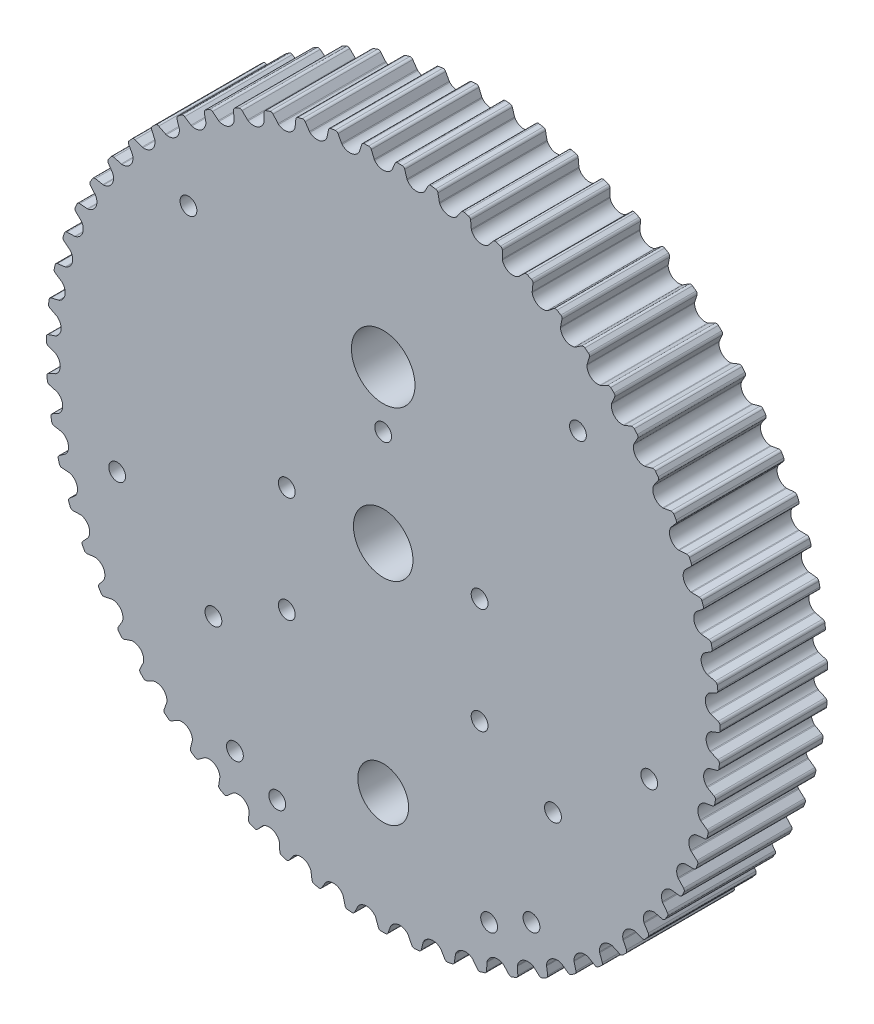
from build123d import *

# Parameters (mm, degrees)
BOSS_EXTRUDE1_DEPTH = 25.4
SKETCH3_R           = 7.025
SKETCH3_R_2         = 6
SKETCH3_R_3         = 7.5
CUT_EXTRUDE1_DEPTH  = 116.295759829
SKETCH4_R           = 1.985
CUT_EXTRUDE2_DEPTH  = 116.295759829


with BuildPart() as part:
    # Sketch1 → Boss-Extrude1 (new body)
    with BuildSketch(Plane.XY):
        with BuildLine():
            ThreePointArc((-2.00858237, 77.225966305), (-2.06415437, 77.308346172), (-2.108533634, 77.397257198))
            Line((-2.108533634, 77.397257198), (-2.806365183, 79.058376339))
            ThreePointArc((-2.806365183, 79.058376339), (-3.057533909, 79.355500397), (-3.433430091, 79.455852257))
            ThreePointArc((-3.433430091, 79.455852257), (-3.69885733, 79.443938437), (-3.964243287, 79.431137945))
            ThreePointArc((-3.964243287, 79.431137945), (-4.229584998, 79.417450921), (-4.494879503, 79.402877519))
            ThreePointArc((-4.494879503, 79.402877519), (-4.858915954, 79.265597157), (-5.079252563, 78.944941245))
            Line((-5.079252563, 78.944941245), (-5.608222375, 77.222594994))
            ThreePointArc((-5.608222375, 77.222594994), (-5.643528429, 77.129707039), (-5.690621893, 77.042203352))
            ThreePointArc((-5.690621893, 77.042203352), (-7.591122322, 75.861842835), (-9.687824439, 76.642222909))
            ThreePointArc((-9.687824439, 76.642222909), (-9.751322675, 76.718660228), (-9.804334089, 76.802710687))
            Line((-9.804334089, 76.802710687), (-10.664092012, 78.386093769))
            ThreePointArc((-10.664092012, 78.386093769), (-10.943596627, 78.656733022), (-11.327616714, 78.719159038))
            ThreePointArc((-11.327616714, 78.719159038), (-11.590538753, 78.680876402), (-11.853331429, 78.64171561))
            ThreePointArc((-11.853331429, 78.64171561), (-12.11599181, 78.601677097), (-12.378516965, 78.560761311))
            ThreePointArc((-12.378516965, 78.560761311), (-12.727075727, 78.3879168), (-12.914390416, 78.046915859))
            Line((-12.914390416, 78.046915859), (-13.26924135, 76.280459947))
            ThreePointArc((-13.26924135, 76.280459947), (-13.295123307, 76.184518226), (-13.333270199, 76.092760369))
            ThreePointArc((-13.333270199, 76.092760369), (-15.10680066, 74.729036594), (-17.270784557, 75.29677467))
            ThreePointArc((-17.270784557, 75.29677467), (-17.341577955, 75.366509771), (-17.402694666, 75.444864333))
            Line((-17.402694666, 75.444864333), (-18.415834303, 76.934774984))
            ThreePointArc((-18.415834303, 76.934774984), (-18.720896964, 77.176239697), (-19.109224393, 77.20011945))
            ThreePointArc((-19.109224393, 77.20011945), (-19.367028194, 77.135848468), (-19.624615838, 77.070716574))
            ThreePointArc((-19.624615838, 77.070716574), (-19.881984453, 77.004724493), (-20.139131164, 76.937872962))
            ThreePointArc((-20.139131164, 76.937872962), (-20.468748104, 76.73118211), (-20.621179254, 76.373225158))
            Line((-20.621179254, 76.373225158), (-20.798384643, 74.58021542))
            ThreePointArc((-20.798384643, 74.58021542), (-20.814585277, 74.482173443), (-20.843406476, 74.387073348))
            ThreePointArc((-20.843406476, 74.387073348), (-22.472340826, 72.853539614), (-24.682099858, 73.202993255))
            ThreePointArc((-24.682099858, 73.202993255), (-24.759484842, 73.265333081), (-24.828099445, 73.337213021))
            Line((-24.828099445, 73.337213021), (-25.984551758, 74.71884384))
            ThreePointArc((-25.984551758, 74.71884384), (-26.312140616, 74.928734228), (-26.700916015, 74.913830392))
            ThreePointArc((-26.700916015, 74.913830392), (-26.951039407, 74.824209818), (-27.200861999, 74.733754131))
            ThreePointArc((-27.200861999, 74.733754131), (-27.450381001, 74.642464341), (-27.69959363, 74.550341466))
            ThreePointArc((-27.69959363, 74.550341466), (-28.006992866, 74.311858458), (-28.123025549, 73.940503033))
            Line((-28.123025549, 73.940503033), (-28.120824246, 72.138759204))
            ThreePointArc((-28.120824246, 72.138759204), (-28.127182546, 72.039591358), (-28.146391615, 71.942094172))
            ThreePointArc((-28.146391615, 71.942094172), (-29.614540772, 70.253991426), (-31.848113362, 70.381687605))
            ThreePointArc((-31.848113362, 70.381687605), (-31.931320845, 70.436012594), (-32.006751418, 70.500703539))
            Line((-32.006751418, 70.500703539), (-33.295023065, 71.760323257))
            ThreePointArc((-33.295023065, 71.760323257), (-33.641882394, 71.936553336), (-34.027241938, 71.88301403))
            ThreePointArc((-34.027241938, 71.88301403), (-34.267199083, 71.768934554), (-34.506773772, 71.654054064))
            ThreePointArc((-34.506773772, 71.654054064), (-34.745963331, 71.538373844), (-34.98476509, 71.421895183))
            ThreePointArc((-34.98476509, 71.421895183), (-35.26689155, 71.153990171), (-35.345372581, 70.77292697))
            Line((-35.345372581, 70.77292697), (-35.163786463, 68.98035559))
            ThreePointArc((-35.163786463, 68.98035559), (-35.160239239, 68.881047449), (-35.169645269, 68.782122143))
            ThreePointArc((-35.169645269, 68.782122143), (-36.462418108, 66.956227509), (-38.697606007, 66.860897123))
            ThreePointArc((-38.697606007, 66.860897123), (-38.785809036, 66.90666737), (-38.867305915, 66.963526391))
            Line((-38.867305915, 66.963526391), (-40.274593474, 68.088616342))
            ThreePointArc((-40.274593474, 68.088616342), (-40.637276031, 68.229434657), (-41.015389843, 68.137791981))
            ThreePointArc((-41.015389843, 68.137791981), (-41.242795939, 68.000387375), (-41.469741725, 67.862223816))
            ThreePointArc((-41.469741725, 67.862223816), (-41.696224666, 67.723302847), (-41.922242237, 67.583626019))
            ThreePointArc((-41.922242237, 67.583626019), (-42.176292022, 67.288961563), (-42.21644142, 66.901977763))
            Line((-42.21644142, 66.901977763), (-41.857275173, 65.136394212))
            ThreePointArc((-41.857275173, 65.136394212), (-41.843857678, 65.037932745), (-41.843367187, 64.938562482))
            ThreePointArc((-41.843367187, 64.938562482), (-42.947915551, 62.993022521), (-45.162504458, 62.675613008))
            ThreePointArc((-45.162504458, 62.675613008), (-45.254826431, 62.712373626), (-45.341579664, 62.760835633))
            Line((-45.341579664, 62.760835633), (-46.853896879, 63.740214167))
            ThreePointArc((-46.853896879, 63.740214167), (-47.228798161, 63.844221204), (-47.595908377, 63.715385943))
            ThreePointArc((-47.595908377, 63.715385943), (-47.80850336, 63.556021795), (-48.020564753, 63.395948299))
            ThreePointArc((-48.020564753, 63.395948299), (-48.232090189, 63.235167241), (-48.443077306, 63.073680416))
            ThreePointArc((-48.443077306, 63.073680416), (-48.666525555, 62.755185023), (-48.667944298, 62.366126644))
            Line((-48.667944298, 62.366126644), (-48.134767477, 60.645078084))
            ThreePointArc((-48.134767477, 60.645078084), (-48.11161306, 60.548441845), (-48.101230924, 60.449614213))
            ThreePointArc((-48.101230924, 60.449614213), (-49.006577314, 58.403764575), (-51.17855765, 57.867430492))
            ThreePointArc((-51.17855765, 57.867430492), (-51.274081029, 57.894816138), (-51.365228424, 57.934399494))
            Line((-51.365228424, 57.934399494), (-52.967545206, 58.758333108))
            ThreePointArc((-52.967545206, 58.758333108), (-53.350939277, 58.824495197), (-53.70339739, 58.659747773))
            ThreePointArc((-53.70339739, 58.659747773), (-53.899068396, 58.480007918), (-54.094137835, 58.299615367))
            ThreePointArc((-54.094137835, 58.299615367), (-54.288603529, 58.118572134), (-54.482463308, 57.936880239))
            ThreePointArc((-54.482463308, 57.936880239), (-54.673089293, 57.597719261), (-54.635763281, 57.210452939))
            Line((-54.635763281, 57.210452939), (-53.933874836, 55.551043924))
            ThreePointArc((-53.933874836, 55.551043924), (-53.901213616, 55.457193328), (-53.881043017, 55.359890519))
            ThreePointArc((-53.881043017, 55.359890519), (-54.578189694, 53.234063777), (-56.685975343, 52.484135454))
            ThreePointArc((-56.685975343, 52.484135454), (-56.783750775, 52.501873957), (-56.878386467, 52.532185265))
            Line((-56.878386467, 52.532185265), (-58.554778273, 53.192485336))
            ThreePointArc((-58.554778273, 53.192485336), (-58.942854789, 53.220144929), (-59.277157912, 53.021122677))
            ThreePointArc((-59.277157912, 53.021122677), (-59.453960275, 52.822793448), (-59.630099072, 52.623874664))
            ThreePointArc((-59.630099072, 52.623874664), (-59.805572338, 52.424368545), (-59.980378113, 52.224277318))
            ThreePointArc((-59.980378113, 52.224277318), (-60.136287306, 51.867821488), (-60.060587502, 51.48619605))
            Line((-60.060587502, 51.48619605), (-59.196963116, 49.904918532))
            ThreePointArc((-59.196963116, 49.904918532), (-59.155119696, 49.814786308), (-59.125361097, 49.719975362))
            ThreePointArc((-59.125361097, 49.719975362), (-59.607379505, 47.535298937), (-61.630022345, 46.579229498))
            ThreePointArc((-61.630022345, 46.579229498), (-61.729078094, 46.587144566), (-61.826261552, 46.607882577))
            Line((-61.826261552, 46.607882577), (-63.560067646, 47.097986747))
            ThreePointArc((-63.560067646, 47.097986747), (-63.948969729, 47.08686895), (-64.261795408, 46.855549842))
            ThreePointArc((-64.261795408, 46.855549842), (-64.417971986, 46.640602325), (-64.573429595, 46.425134253))
            ThreePointArc((-64.573429595, 46.425134253), (-64.7281665, 46.209148029), (-64.882180973, 45.992646066))
            ThreePointArc((-64.882180973, 45.992646066), (-65.001823879, 45.622438002), (-64.888502621, 45.250246213))
            Line((-64.888502621, 45.250246213), (-63.871725381, 43.762815639))
            ThreePointArc((-63.871725381, 43.762815639), (-63.821115619, 43.677297561), (-63.782064776, 43.585920752))
            ThreePointArc((-63.782064776, 43.585920752), (-64.044164399, 41.36410694), (-65.961562497, 40.211398233))
            ThreePointArc((-65.961562497, 40.211398233), (-66.060914102, 40.209411201), (-66.159679472, 40.220369813))
            Line((-66.159679472, 40.220369813), (-67.933668512, 40.535407206))
            ThreePointArc((-67.933668512, 40.535407206), (-68.319531077, 40.485622513), (-68.60777031, 40.224305502))
            ThreePointArc((-68.60777031, 40.224305502), (-68.74176895, 39.994875943), (-68.875000363, 39.765))
            ThreePointArc((-68.875000363, 39.765), (-69.007463062, 39.53468024), (-69.139155569, 39.303919234))
            ThreePointArc((-69.139155569, 39.303919234), (-69.221343123, 38.923638231), (-69.071526649, 38.5645791))
            Line((-69.071526649, 38.5645791), (-67.911701744, 37.185778223))
            ThreePointArc((-67.911701744, 37.185778223), (-67.852828622, 37.105724209), (-67.80487364, 37.018689679))
            ThreePointArc((-67.80487364, 37.018689679), (-67.844449614, 34.781819864), (-69.637547006, 33.443928026))
            ThreePointArc((-69.637547006, 33.443928026), (-69.736207066, 33.432058643), (-69.835572775, 33.433128944))
            Line((-69.835572775, 33.433128944), (-71.632114059, 33.569968577))
            ThreePointArc((-71.632114059, 33.569968577), (-72.011102232, 33.48201177), (-72.271890367, 33.193293943))
            ThreePointArc((-72.271890367, 33.193293943), (-72.382379331, 32.951662514), (-72.492060434, 32.709663312))
            ThreePointArc((-72.492060434, 32.709663312), (-72.600932454, 32.467299037), (-72.708994175, 32.224572395))
            ThreePointArc((-72.708994175, 32.224572395), (-72.75290956, 31.837997856), (-72.568086813, 31.495639874))
            Line((-72.568086813, 31.495639874), (-71.276741104, 30.239171836))
            ThreePointArc((-71.276741104, 30.239171836), (-71.210189731, 30.165377498), (-71.153807206, 30.083550238))
            ThreePointArc((-71.153807206, 30.083550238), (-70.970466208, 27.853855436), (-72.621442287, 26.344077037))
            ThreePointArc((-72.621442287, 26.344077037), (-72.718430274, 26.322443267), (-72.81740878, 26.313614619))
            Line((-72.81740878, 26.313614619), (-74.618647475, 26.270896518))
            ThreePointArc((-74.618647475, 26.270896518), (-74.986994701, 26.145641752), (-75.217739908, 25.832392516))
            ThreePointArc((-75.217739908, 25.832392516), (-75.303621106, 25.58096066), (-75.388661841, 25.329243295))
            ThreePointArc((-75.388661841, 25.329243295), (-75.472861162, 25.07724323), (-75.556218131, 24.824963278))
            ThreePointArc((-75.556218131, 24.824963278), (-75.561424896, 24.435937154), (-75.343432728, 24.113682829))
            Line((-75.343432728, 24.113682829), (-73.933400189, 22.992034974))
            ThreePointArc((-73.933400189, 22.992034974), (-73.859831981, 22.925233714), (-73.79558227, 22.849426958))
            ThreePointArc((-73.79558227, 22.849426958), (-73.391146424, 20.64906688), (-74.883593049, 18.982406775))
            ThreePointArc((-74.883593049, 18.982406775), (-74.977945052, 18.951223623), (-75.075552662, 18.93258377))
            Line((-75.075552662, 18.93258377), (-76.863587248, 18.710732487))
            ThreePointArc((-76.863587248, 18.710732487), (-77.217632726, 18.5494246), (-77.416041757, 18.214757166))
            ThreePointArc((-77.416041757, 18.214757166), (-77.476461664, 17.956023725), (-77.536016856, 17.697089878))
            ThreePointArc((-77.536016856, 17.697089878), (-77.594706668, 17.437958512), (-77.652530446, 17.178632522))
            ThreePointArc((-77.652530446, 17.178632522), (-77.618976844, 16.791021131), (-77.369981759, 16.492073171))
            Line((-77.369981759, 16.492073171), (-75.855275927, 15.516392939))
            ThreePointArc((-75.855275927, 15.516392939), (-75.775422038, 15.457248658), (-75.703943683, 15.388215808))
            ThreePointArc((-75.703943683, 15.388215808), (-75.082432455, 13.239058619), (-76.401517019, 11.432080827))
            ThreePointArc((-76.401517019, 11.432080827), (-76.492295327, 11.391658204), (-76.587561973, 11.363392398))
            Line((-76.587561973, 11.363392398), (-78.344622159, 10.96461279))
            ThreePointArc((-78.344622159, 10.96461279), (-78.680847227, 10.768854933), (-78.844948203, 10.416095376))
            ThreePointArc((-78.844948203, 10.416095376), (-78.879306338, 10.15263176), (-78.912784101, 9.889054831))
            ThreePointArc((-78.912784101, 9.889054831), (-78.945381118, 9.625367529), (-78.977097026, 9.361572799))
            ThreePointArc((-78.977097026, 9.361572799), (-78.905116528, 8.979228396), (-78.627593151, 8.70655788))
            Line((-78.627593151, 8.70655788), (-77.023267853, 7.88654202))
            ThreePointArc((-77.023267853, 7.88654202), (-76.937921907, 7.83564252), (-76.859925292, 7.774069656))
            ThreePointArc((-76.859925292, 7.774069656), (-76.02751554, 5.697474646), (-77.160128389, 3.768137723))
            ThreePointArc((-77.160128389, 3.768137723), (-77.246430806, 3.718877369), (-77.338409685, 3.681266527))
            Line((-77.338409685, 3.681266527), (-79.047033017, 3.109521846))
            ThreePointArc((-79.047033017, 3.109521846), (-79.362096118, 2.881259547), (-79.49025813, 2.513913751))
            ThreePointArc((-79.49025813, 2.513913751), (-79.498213027, 2.248338379), (-79.505280645, 1.982737914))
            ThreePointArc((-79.505280645, 1.982737914), (-79.511460903, 1.717115319), (-79.516753735, 1.45147356))
            ThreePointArc((-79.516753735, 1.45147356), (-79.407061715, 1.078196055), (-79.103768198, 0.834512905))
            Line((-79.103768198, 0.834512905), (-77.425767939, 0.178311104))
            ThreePointArc((-77.425767939, 0.178311104), (-77.335778143, 0.136162246), (-77.252038432, 0.082661306))
            ThreePointArc((-77.252038432, 0.082661306), (-76.217003018, -1.90073339), (-77.151887737, -3.933254827))
            ThreePointArc((-77.151887737, -3.933254827), (-77.23285655, -3.990863341), (-77.320633535, -4.037445425))
            Line((-77.320633535, -4.037445425), (-78.963838947, -4.776472924))
            ThreePointArc((-78.963838947, -4.776472924), (-79.254608844, -5.034971091), (-79.34555816, -5.413252278))
            ThreePointArc((-79.34555816, -5.413252278), (-79.32703076, -5.678299998), (-79.30761799, -5.943284343))
            ThreePointArc((-79.30761799, -5.943284343), (-79.287320068, -6.208202354), (-79.26613722, -6.473051076))
            ThreePointArc((-79.26613722, -6.473051076), (-79.119823847, -6.833551883), (-78.793774457, -7.045825835))
            Line((-78.793774457, -7.045825835), (-77.058775958, -7.531691949))
            ThreePointArc((-77.058775958, -7.531691949), (-76.96503667, -7.564671269), (-76.876386108, -7.609568568))
            ThreePointArc((-76.876386108, -7.609568568), (-75.649011679, -9.480051083), (-76.376876962, -11.595556923))
            ThreePointArc((-76.376876962, -11.595556923), (-76.451707468, -11.660941057), (-76.534410191, -11.71603143))
            Line((-76.534410191, -11.71603143), (-78.09586677, -12.61499696))
            ThreePointArc((-78.09586677, -12.61499696), (-78.35945366, -12.901161924), (-78.412286386, -13.286618975))
            ThreePointArc((-78.412286386, -13.286618975), (-78.367460821, -13.54850488), (-78.321760597, -13.81023957))
            ThreePointArc((-78.321760597, -13.81023957), (-78.275186224, -14.071820124), (-78.227738222, -14.333243622))
            ThreePointArc((-78.227738222, -14.333243622), (-78.046257623, -14.677384912), (-77.700692786, -14.856139991))
            Line((-77.700692786, -14.856139991), (-75.925939242, -15.166841663))
            ThreePointArc((-75.925939242, -15.166841663), (-75.829382086, -15.190323683), (-75.736701721, -15.226171131))
            ThreePointArc((-75.736701721, -15.226171131), (-74.329186474, -16.965151769), (-74.842798471, -19.142617164))
            ThreePointArc((-74.842798471, -19.142617164), (-74.910746969, -19.215127103), (-74.987553495, -19.278178251))
            Line((-74.987553495, -19.278178251), (-76.451742783, -20.328147489))
            ThreePointArc((-76.451742783, -20.328147489), (-76.685527021, -20.639135214), (-76.699718081, -21.027937283))
            ThreePointArc((-76.699718081, -21.027937283), (-76.629039849, -21.284058633), (-76.55750636, -21.539942431))
            ThreePointArc((-76.55750636, -21.539942431), (-76.485118413, -21.795585823), (-76.411876815, -22.050985954))
            ThreePointArc((-76.411876815, -22.050985954), (-76.197032628, -22.375347496), (-75.835386721, -22.518807154))
            Line((-75.835386721, -22.518807154), (-74.03851643, -22.651256491))
            ThreePointArc((-74.03851643, -22.651256491), (-73.940101034, -22.665007835), (-73.844311965, -22.691449165))
            ThreePointArc((-73.844311965, -22.691449165), (-72.270644421, -24.281645156), (-72.564898624, -26.499429476))
            ThreePointArc((-72.564898624, -26.499429476), (-72.625289812, -26.578344583), (-72.695436802, -26.648729876))
            Line((-72.695436802, -26.648729876), (-74.047807028, -27.839267755))
            ThreePointArc((-74.047807028, -27.839267755), (-74.249465162, -28.171987505), (-74.224873518, -28.560270502))
            ThreePointArc((-74.224873518, -28.560270502), (-74.129045051, -28.808081849), (-74.03238923, -29.055571668))
            ThreePointArc((-74.03238923, -29.055571668), (-73.934907133, -29.302737198), (-73.836599848, -29.54957568))
            ThreePointArc((-73.836599848, -29.54957568), (-73.590527289, -29.850933824), (-73.216394513, -29.957672294))
            Line((-73.216394513, -29.957672294), (-71.415265579, -29.910552956))
            ThreePointArc((-71.415265579, -29.910552956), (-71.315970039, -29.914436957), (-71.218024262, -29.931209383))
            ThreePointArc((-71.218024262, -29.931209383), (-69.493844234, -31.356816644), (-69.565816213, -33.592878553))
            ThreePointArc((-69.565816213, -33.592878553), (-69.618049897, -33.677414533), (-69.680840198, -33.754434451))
            Line((-69.680840198, -33.754434451), (-70.9079509, -35.073708871))
            ThreePointArc((-70.9079509, -35.073708871), (-71.075478761, -35.424853928), (-71.012348816, -35.808758923))
            ThreePointArc((-71.012348816, -35.808758923), (-70.8923225, -36.045797405), (-70.771504955, -36.282433579))
            ThreePointArc((-70.771504955, -36.282433579), (-70.649897529, -36.518664806), (-70.527501579, -36.754488447))
            ThreePointArc((-70.527501579, -36.754488447), (-70.252646228, -37.02984816), (-69.869744883, -37.098804628))
            Line((-69.869744883, -37.098804628), (-68.082257733, -36.872584907))
            ThreePointArc((-68.082257733, -36.872584907), (-67.983068894, -36.866562964), (-67.883939837, -36.873499794))
            ThreePointArc((-67.883939837, -36.873499794), (-66.026383002, -38.12035), (-65.875357467, -40.35246651))
            ThreePointArc((-65.875357467, -40.35246651), (-65.918914524, -40.441783207), (-65.973724099, -40.524672291))
            Line((-65.973724099, -40.524672291), (-67.0633797, -41.95957171))
            ThreePointArc((-67.0633797, -41.95957171), (-67.195112319, -42.325652237), (-67.094071488, -42.701363809))
            ThreePointArc((-67.094071488, -42.701363809), (-66.951040198, -42.925273632), (-66.807261668, -43.148704365))
            ThreePointArc((-66.807261668, -43.148704365), (-66.662737502, -43.371653516), (-66.517469313, -43.594118596))
            ThreePointArc((-66.517469313, -43.594118596), (-66.216562807, -43.840743229), (-65.828698337, -43.871232375))
            Line((-65.828698337, -43.871232375), (-64.072617824, -43.468160543))
            ThreePointArc((-64.072617824, -43.468160543), (-63.974521468, -43.452292506), (-63.87519432, -43.449324799))
            ThreePointArc((-63.87519432, -43.449324799), (-61.902721912, -44.505026192), (-61.530199822, -46.711013526))
            ThreePointArc((-61.530199822, -46.711013526), (-61.564647364, -46.804223271), (-61.61093149, -46.892157731))
            Line((-61.61093149, -46.892157731), (-62.552302502, -48.428421475))
            ThreePointArc((-62.552302502, -48.428421475), (-62.646930663, -48.805799198), (-62.508983134, -49.169583358))
            ThreePointArc((-62.508983134, -49.169583358), (-62.34436838, -49.378139204), (-62.179057801, -49.586143942))
            ThreePointArc((-62.179057801, -49.586143942), (-62.013053241, -49.793595248), (-61.846356553, -50.000490808))
            ThreePointArc((-61.846356553, -50.000490808), (-61.522389436, -50.215929295), (-61.133416613, -50.207648104))
            Line((-61.133416613, -50.207648104), (-59.426195452, -49.631730072))
            ThreePointArc((-59.426195452, -49.631730072), (-59.330166505, -49.606173643), (-59.231628424, -49.593330893))
            ThreePointArc((-59.231628424, -49.593330893), (-57.163843761, -50.447391438), (-56.573527408, -52.605325504))
            ThreePointArc((-56.573527408, -52.605325504), (-56.598523079, -52.701501936), (-56.635821764, -52.793607841))
            Line((-56.635821764, -52.793607841), (-57.419552419, -54.41596783))
            ThreePointArc((-57.419552419, -54.41596783), (-57.476135664, -54.800892201), (-57.302652422, -55.149133496))
            ThreePointArc((-57.302652422, -55.149133496), (-57.118090219, -55.340262646), (-56.932890522, -55.530774142))
            ThreePointArc((-56.932890522, -55.530774142), (-56.747055396, -55.72066586), (-56.560586916, -55.90993568))
            ThreePointArc((-56.560586916, -55.90993568), (-56.216778918, -56.092046896), (-55.830563529, -56.045077669))
            Line((-55.830563529, -56.045077669), (-54.189168851, -55.302037168))
            ThreePointArc((-54.189168851, -55.302037168), (-54.096161693, -55.26704634), (-53.999391995, -55.244456184))
            ThreePointArc((-53.999391995, -55.244456184), (-51.856845649, -55.888387845), (-51.054601862, -57.976822123))
            ThreePointArc((-51.054601862, -57.976822123), (-51.069897244, -58.075009398), (-51.097839797, -58.170371358))
            Line((-51.097839797, -58.170371358), (-51.716141027, -59.862703849))
            ThreePointArc((-51.716141027, -59.862703849), (-51.734117007, -60.251349316), (-51.526822206, -60.580586769))
            ThreePointArc((-51.526822206, -60.580586769), (-51.324146817, -60.752389694), (-51.120898598, -60.923514561))
            ThreePointArc((-51.120898598, -60.923514561), (-50.91707982, -61.093959461), (-50.712692755, -61.263722491))
            ThreePointArc((-50.712692755, -61.263722491), (-50.352460794, -61.410696534), (-49.972841221, -61.325506073))
            Line((-49.972841221, -61.325506073), (-48.413585945, -60.422727774))
            ThreePointArc((-48.413585945, -60.422727774), (-48.324524922, -60.378650301), (-48.230485347, -60.34653725))
            ThreePointArc((-48.230485347, -60.34653725), (-46.034470906, -60.773940343), (-45.028272746, -62.772119037))
            ThreePointArc((-45.028272746, -62.772119037), (-45.033715825, -62.871341325), (-45.05202454, -62.96901159))
            Line((-45.05202454, -62.96901159), (-45.498751392, -64.714497422))
            ThreePointArc((-45.498751392, -64.714497422), (-45.477941452, -65.103001453), (-45.238895282, -65.409962954))
            ThreePointArc((-45.238895282, -65.409962954), (-45.020120985, -65.560732199), (-44.800844218, -65.710769721))
            ThreePointArc((-44.800844218, -65.710769721), (-44.581067429, -65.860073845), (-44.36079307, -66.008642905))
            ThreePointArc((-44.36079307, -66.008642905), (-43.987717294, -66.11901908), (-43.618466366, -65.996454046))
            Line((-43.618466366, -65.996454046), (-42.156847072, -64.942910166))
            ThreePointArc((-42.156847072, -64.942910166), (-42.072617311, -64.890184109), (-41.982242468, -64.848867317))
            ThreePointArc((-41.982242468, -64.848867317), (-39.75458491, -65.055494119), (-38.554432425, -66.94355843))
            ThreePointArc((-38.554432425, -66.94355843), (-38.549969107, -67.042829616), (-38.558462024, -67.141837494))
            Line((-38.558462024, -67.141837494), (-38.829174724, -68.923129246))
            ThreePointArc((-38.829174724, -68.923129246), (-38.769785684, -69.307630712), (-38.501363892, -69.589265541))
            ThreePointArc((-38.501363892, -69.589265541), (-38.268664964, -69.717502694), (-38.03553892, -69.84496173))
            ThreePointArc((-38.03553892, -69.84496173), (-37.801988361, -69.971641227), (-37.568015894, -70.09753977))
            ThreePointArc((-37.568015894, -70.09753977), (-37.185804097, -70.170221109), (-36.830591596, -70.011499609))
            Line((-36.830591596, -70.011499609), (-35.481134512, -68.817660739))
            ThreePointArc((-35.481134512, -68.817660739), (-35.402573128, -68.756810114), (-35.316761201, -68.706700205))
            ThreePointArc((-35.316761201, -68.706700205), (-33.079599989, -68.690497167), (-31.697420833, -70.449682663))
            ThreePointArc((-31.697420833, -70.449682663), (-31.683095476, -70.548016146), (-31.681688189, -70.647377653))
            Line((-31.681688189, -70.647377653), (-31.773696272, -72.446772047))
            ThreePointArc((-31.773696272, -72.446772047), (-31.676318367, -72.8234496), (-31.38118865, -73.076958742))
            ThreePointArc((-31.38118865, -73.076958742), (-31.136877758, -73.181389325), (-30.892219348, -73.28500313))
            ThreePointArc((-30.892219348, -73.28500313), (-30.647216149, -73.387799002), (-30.401870897, -73.489775792))
            ThreePointArc((-30.401870897, -73.489775792), (-30.014321672, -73.524039956), (-29.67667786, -73.330739435))
            Line((-29.67667786, -73.330739435), (-28.452794497, -72.008470482))
            ThreePointArc((-28.452794497, -72.008470482), (-28.380682267, -71.940100049), (-28.300286095, -71.88169504))
            ThreePointArc((-28.300286095, -71.88169504), (-26.075855141, -71.642823194), (-24.525386033, -73.2556463))
            ThreePointArc((-24.525386033, -73.2556463), (-24.501341009, -73.352064796), (-24.490047503, -73.450792433))
            Line((-24.490047503, -73.450792433), (-24.402436553, -75.250406279))
            ThreePointArc((-24.402436553, -75.250406279), (-24.268037567, -75.615516328), (-23.949133056, -75.838380296))
            ThreePointArc((-23.949133056, -75.838380296), (-23.695638272, -75.91796643), (-23.441879021, -75.996705244))
            ThreePointArc((-23.441879021, -75.996705244), (-23.187858135, -76.074595859), (-22.933578449, -76.151637405))
            ThreePointArc((-22.933578449, -76.151637405), (-22.544543434, -76.147143861), (-22.227823967, -75.921185426))
            Line((-22.227823967, -75.921185426), (-21.141677827, -74.483627694))
            ThreePointArc((-21.141677827, -74.483627694), (-21.076731436, -74.40841695), (-21.002550032, -74.342297294))
            ThreePointArc((-21.002550032, -74.342297294), (-18.81295673, -73.883130656), (-17.109606927, -75.333562412))
            ThreePointArc((-17.109606927, -75.333562412), (-17.076081206, -75.427107672), (-17.055013722, -75.524220239))
            Line((-17.055013722, -75.524220239), (-16.788654455, -77.306168165))
            ThreePointArc((-16.788654455, -77.306168165), (-16.618570107, -77.656082083), (-16.279060219, -77.846085954))
            ThreePointArc((-16.279060219, -77.846085954), (-16.018900887, -77.900036678), (-15.758562769, -77.953117959))
            ThreePointArc((-15.758562769, -77.953117959), (-15.498048769, -78.005329205), (-15.237361795, -78.056669834))
            ThreePointArc((-15.237361795, -78.056669834), (-14.850707394, -78.01346324), (-14.558059972, -77.757092568))
            Line((-14.558059972, -77.757092568), (-13.620445664, -76.218533151))
            ThreePointArc((-13.620445664, -76.218533151), (-13.563310579, -76.137229574), (-13.49608119, -76.064052399))
            ThreePointArc((-13.49608119, -76.064052399), (-11.363086703, -75.389154373), (-9.523784861, -76.662779735))
            ThreePointArc((-9.523784861, -76.662779735), (-9.481111637, -76.752522064), (-9.450479553, -76.847054413))
            Line((-9.450479553, -76.847054413), (-9.008019167, -78.593626622))
            ThreePointArc((-9.008019167, -78.593626622), (-8.803939831, -78.924866806), (-8.447198768, -79.080122237))
            ThreePointArc((-8.447198768, -79.080122237), (-8.182960469, -79.107901362), (-7.91863084, -79.134797565))
            ThreePointArc((-7.91863084, -79.134797565), (-7.654212831, -79.160810544), (-7.389709393, -79.185940009))
            ThreePointArc((-7.389709393, -79.185940009), (-7.009278353, -79.104449773), (-6.743611438, -78.82021479))
            Line((-6.743611438, -78.82021479), (-5.963847394, -77.195944583))
            ThreePointArc((-5.963847394, -77.195944583), (-5.915091447, -77.109356204), (-5.85548223, -77.029848778))
            ThreePointArc((-5.85548223, -77.029848778), (-3.800285215, -76.145926804), (-1.843311143, -77.230087912))
            ThreePointArc((-1.843311143, -77.230087912), (-1.791914521, -77.31513541), (-1.752022272, -77.406148036))
            Line((-1.752022272, -77.406148036), (-1.137858137, -79.099986307))
            ThreePointArc((-1.137858137, -79.099986307), (-0.901812046, -79.409260744), (-0.53138526, -79.528224736))
            ThreePointArc((-0.53138526, -79.528224736), (-0.265694113, -79.529556183), (0, -79.53))
            ThreePointArc((0, -79.53), (0.265694113, -79.529556183), (0.53138526, -79.528224736))
            ThreePointArc((0.53138526, -79.528224736), (0.901812046, -79.409260744), (1.137858137, -79.099986307))
            Line((1.137858137, -79.099986307), (1.752022272, -77.406148036))
            ThreePointArc((1.752022272, -77.406148036), (1.791914521, -77.31513541), (1.843311143, -77.230087912))
            ThreePointArc((1.843311143, -77.230087912), (3.800285215, -76.145926804), (5.85548223, -77.029848778))
            ThreePointArc((5.85548223, -77.029848778), (5.915091447, -77.109356204), (5.963847394, -77.195944583))
            Line((5.963847394, -77.195944583), (6.743611438, -78.82021479))
            ThreePointArc((6.743611438, -78.82021479), (7.009278353, -79.104449773), (7.389709393, -79.185940009))
            ThreePointArc((7.389709393, -79.185940009), (7.654212831, -79.160810544), (7.91863084, -79.134797565))
            ThreePointArc((7.91863084, -79.134797565), (8.182960469, -79.107901362), (8.447198768, -79.080122237))
            ThreePointArc((8.447198768, -79.080122237), (8.803939831, -78.924866806), (9.008019167, -78.593626622))
            Line((9.008019167, -78.593626622), (9.450479553, -76.847054413))
            ThreePointArc((9.450479553, -76.847054413), (9.481111637, -76.752522064), (9.523784861, -76.662779735))
            ThreePointArc((9.523784861, -76.662779735), (11.363086703, -75.389154373), (13.49608119, -76.064052399))
            ThreePointArc((13.49608119, -76.064052399), (13.563310579, -76.137229574), (13.620445664, -76.218533151))
            Line((13.620445664, -76.218533151), (14.558059972, -77.757092568))
            ThreePointArc((14.558059972, -77.757092568), (14.850707394, -78.01346324), (15.237361795, -78.056669834))
            ThreePointArc((15.237361795, -78.056669834), (15.498048769, -78.005329205), (15.758562769, -77.953117959))
            ThreePointArc((15.758562769, -77.953117959), (16.018900887, -77.900036678), (16.279060219, -77.846085954))
            ThreePointArc((16.279060219, -77.846085954), (16.618570107, -77.656082083), (16.788654455, -77.306168165))
            Line((16.788654455, -77.306168165), (17.055013722, -75.524220239))
            ThreePointArc((17.055013722, -75.524220239), (17.076081206, -75.427107672), (17.109606927, -75.333562412))
            ThreePointArc((17.109606927, -75.333562412), (18.81295673, -73.883130656), (21.002550032, -74.342297294))
            ThreePointArc((21.002550032, -74.342297294), (21.076731436, -74.40841695), (21.141677827, -74.483627694))
            Line((21.141677827, -74.483627694), (22.227823967, -75.921185426))
            ThreePointArc((22.227823967, -75.921185426), (22.544543434, -76.147143861), (22.933578449, -76.151637405))
            ThreePointArc((22.933578449, -76.151637405), (23.187858135, -76.074595859), (23.441879021, -75.996705244))
            ThreePointArc((23.441879021, -75.996705244), (23.695638272, -75.91796643), (23.949133056, -75.838380295))
            ThreePointArc((23.949133056, -75.838380295), (24.268037567, -75.615516328), (24.402436553, -75.250406279))
            Line((24.402436553, -75.250406279), (24.490047503, -73.450792433))
            ThreePointArc((24.490047503, -73.450792433), (24.501341009, -73.352064796), (24.525386033, -73.2556463))
            ThreePointArc((24.525386033, -73.2556463), (26.075855141, -71.642823194), (28.300286095, -71.88169504))
            ThreePointArc((28.300286095, -71.88169504), (28.380682267, -71.940100049), (28.452794497, -72.008470482))
            Line((28.452794497, -72.008470482), (29.67667786, -73.330739435))
            ThreePointArc((29.67667786, -73.330739435), (30.014321672, -73.524039956), (30.401870897, -73.489775792))
            ThreePointArc((30.401870897, -73.489775792), (30.647216149, -73.387799002), (30.892219348, -73.28500313))
            ThreePointArc((30.892219348, -73.28500313), (31.136877758, -73.181389325), (31.38118865, -73.076958742))
            ThreePointArc((31.38118865, -73.076958742), (31.676318367, -72.8234496), (31.773696272, -72.446772047))
            Line((31.773696272, -72.446772047), (31.681688189, -70.647377653))
            ThreePointArc((31.681688189, -70.647377653), (31.683095476, -70.548016146), (31.697420833, -70.449682663))
            ThreePointArc((31.697420833, -70.449682663), (33.079599989, -68.690497167), (35.316761201, -68.706700205))
            ThreePointArc((35.316761201, -68.706700205), (35.402573128, -68.756810114), (35.481134512, -68.817660739))
            Line((35.481134512, -68.817660739), (36.830591596, -70.011499609))
            ThreePointArc((36.830591596, -70.011499609), (37.185804097, -70.170221109), (37.568015894, -70.09753977))
            ThreePointArc((37.568015894, -70.09753977), (37.801988361, -69.971641227), (38.03553892, -69.84496173))
            ThreePointArc((38.03553892, -69.84496173), (38.268664964, -69.717502694), (38.501363892, -69.589265541))
            ThreePointArc((38.501363892, -69.589265541), (38.769785684, -69.307630712), (38.829174724, -68.923129246))
            Line((38.829174724, -68.923129246), (38.558462024, -67.141837494))
            ThreePointArc((38.558462024, -67.141837494), (38.549969107, -67.042829616), (38.554432425, -66.94355843))
            ThreePointArc((38.554432425, -66.94355843), (39.75458491, -65.055494119), (41.982242468, -64.848867317))
            ThreePointArc((41.982242468, -64.848867317), (42.072617311, -64.890184109), (42.156847072, -64.942910166))
            Line((42.156847072, -64.942910166), (43.618466366, -65.996454046))
            ThreePointArc((43.618466366, -65.996454046), (43.987717294, -66.11901908), (44.36079307, -66.008642905))
            ThreePointArc((44.36079307, -66.008642905), (44.581067429, -65.860073845), (44.800844218, -65.710769721))
            ThreePointArc((44.800844218, -65.710769721), (45.020120985, -65.560732199), (45.238895282, -65.409962954))
            ThreePointArc((45.238895282, -65.409962954), (45.477941452, -65.103001453), (45.498751392, -64.714497422))
            Line((45.498751392, -64.714497422), (45.052024541, -62.96901159))
            ThreePointArc((45.052024541, -62.96901159), (45.033715825, -62.871341325), (45.028272746, -62.772119037))
            ThreePointArc((45.028272746, -62.772119037), (46.034470906, -60.773940343), (48.230485347, -60.34653725))
            ThreePointArc((48.230485347, -60.34653725), (48.324524922, -60.378650301), (48.413585945, -60.422727774))
            Line((48.413585945, -60.422727774), (49.972841221, -61.325506073))
            ThreePointArc((49.972841221, -61.325506073), (50.352460794, -61.410696534), (50.712692755, -61.263722491))
            ThreePointArc((50.712692755, -61.263722491), (50.91707982, -61.093959461), (51.120898598, -60.923514561))
            ThreePointArc((51.120898598, -60.923514561), (51.324146817, -60.752389694), (51.526822206, -60.580586769))
            ThreePointArc((51.526822206, -60.580586769), (51.734117007, -60.251349316), (51.716141027, -59.862703849))
            Line((51.716141027, -59.862703849), (51.097839797, -58.170371358))
            ThreePointArc((51.097839797, -58.170371358), (51.069897244, -58.075009398), (51.054601863, -57.976822123))
            ThreePointArc((51.054601863, -57.976822123), (51.856845649, -55.888387845), (53.999391995, -55.244456184))
            ThreePointArc((53.999391995, -55.244456184), (54.096161693, -55.26704634), (54.189168851, -55.302037168))
            Line((54.189168851, -55.302037168), (55.830563529, -56.045077669))
            ThreePointArc((55.830563529, -56.045077669), (56.216778918, -56.092046896), (56.560586916, -55.90993568))
            ThreePointArc((56.560586916, -55.90993568), (56.747055396, -55.72066586), (56.932890522, -55.530774142))
            ThreePointArc((56.932890522, -55.530774142), (57.118090219, -55.340262646), (57.302652422, -55.149133496))
            ThreePointArc((57.302652422, -55.149133496), (57.476135664, -54.800892201), (57.419552419, -54.41596783))
            Line((57.419552419, -54.41596783), (56.635821764, -52.793607841))
            ThreePointArc((56.635821764, -52.793607841), (56.598523079, -52.701501936), (56.573527409, -52.605325504))
            ThreePointArc((56.573527409, -52.605325504), (57.163843761, -50.447391438), (59.231628424, -49.593330893))
            ThreePointArc((59.231628424, -49.593330893), (59.330166505, -49.606173643), (59.426195452, -49.631730072))
            Line((59.426195452, -49.631730072), (61.133416613, -50.207648104))
            ThreePointArc((61.133416613, -50.207648104), (61.522389436, -50.215929295), (61.846356553, -50.000490808))
            ThreePointArc((61.846356553, -50.000490808), (62.013053241, -49.793595248), (62.179057801, -49.586143942))
            ThreePointArc((62.179057801, -49.586143942), (62.34436838, -49.378139204), (62.508983134, -49.169583358))
            ThreePointArc((62.508983134, -49.169583358), (62.646930663, -48.805799198), (62.552302502, -48.428421475))
            Line((62.552302502, -48.428421475), (61.61093149, -46.892157731))
            ThreePointArc((61.61093149, -46.892157731), (61.564647364, -46.804223271), (61.530199822, -46.711013526))
            ThreePointArc((61.530199822, -46.711013526), (61.902721912, -44.505026192), (63.87519432, -43.449324799))
            ThreePointArc((63.87519432, -43.449324799), (63.974521468, -43.452292506), (64.072617824, -43.468160543))
            Line((64.072617824, -43.468160543), (65.828698337, -43.871232375))
            ThreePointArc((65.828698337, -43.871232375), (66.216562807, -43.840743229), (66.517469313, -43.594118596))
            ThreePointArc((66.517469313, -43.594118596), (66.662737502, -43.371653516), (66.807261668, -43.148704365))
            ThreePointArc((66.807261668, -43.148704365), (66.951040198, -42.925273632), (67.094071488, -42.701363809))
            ThreePointArc((67.094071488, -42.701363809), (67.195112319, -42.325652237), (67.0633797, -41.95957171))
            Line((67.0633797, -41.95957171), (65.973724099, -40.524672291))
            ThreePointArc((65.973724099, -40.524672291), (65.918914524, -40.441783207), (65.875357467, -40.35246651))
            ThreePointArc((65.875357467, -40.35246651), (66.026383002, -38.12035), (67.883939837, -36.873499794))
            ThreePointArc((67.883939837, -36.873499794), (67.983068894, -36.866562964), (68.082257733, -36.872584907))
            Line((68.082257733, -36.872584907), (69.869744883, -37.098804628))
            ThreePointArc((69.869744883, -37.098804628), (70.252646228, -37.02984816), (70.527501579, -36.754488447))
            ThreePointArc((70.527501579, -36.754488447), (70.649897529, -36.518664806), (70.771504955, -36.282433579))
            ThreePointArc((70.771504955, -36.282433579), (70.8923225, -36.045797405), (71.012348816, -35.808758923))
            ThreePointArc((71.012348816, -35.808758923), (71.075478761, -35.424853928), (70.9079509, -35.073708871))
            Line((70.9079509, -35.073708871), (69.680840198, -33.75443445))
            ThreePointArc((69.680840198, -33.75443445), (69.618049897, -33.677414533), (69.565816213, -33.592878553))
            ThreePointArc((69.565816213, -33.592878553), (69.493844234, -31.356816644), (71.218024262, -29.931209383))
            ThreePointArc((71.218024262, -29.931209383), (71.315970039, -29.914436957), (71.415265579, -29.910552956))
            Line((71.415265579, -29.910552956), (73.216394513, -29.957672294))
            ThreePointArc((73.216394513, -29.957672294), (73.590527289, -29.850933824), (73.836599848, -29.54957568))
            ThreePointArc((73.836599848, -29.54957568), (73.934907133, -29.302737198), (74.03238923, -29.055571668))
            ThreePointArc((74.03238923, -29.055571668), (74.129045051, -28.808081849), (74.224873518, -28.560270502))
            ThreePointArc((74.224873518, -28.560270502), (74.249465162, -28.171987505), (74.047807028, -27.839267755))
            Line((74.047807028, -27.839267755), (72.695436802, -26.648729876))
            ThreePointArc((72.695436802, -26.648729876), (72.625289812, -26.578344583), (72.564898624, -26.499429476))
            ThreePointArc((72.564898624, -26.499429476), (72.270644421, -24.281645156), (73.844311965, -22.691449165))
            ThreePointArc((73.844311965, -22.691449165), (73.940101034, -22.665007835), (74.03851643, -22.651256491))
            Line((74.03851643, -22.651256491), (75.835386721, -22.518807154))
            ThreePointArc((75.835386721, -22.518807154), (76.197032628, -22.375347496), (76.411876816, -22.050985954))
            ThreePointArc((76.411876816, -22.050985954), (76.485118413, -21.795585823), (76.55750636, -21.539942431))
            ThreePointArc((76.55750636, -21.539942431), (76.629039849, -21.284058633), (76.699718081, -21.027937283))
            ThreePointArc((76.699718081, -21.027937283), (76.685527021, -20.639135214), (76.451742783, -20.328147489))
            Line((76.451742783, -20.328147489), (74.987553495, -19.278178251))
            ThreePointArc((74.987553495, -19.278178251), (74.910746969, -19.215127103), (74.842798471, -19.142617164))
            ThreePointArc((74.842798471, -19.142617164), (74.329186474, -16.965151769), (75.736701721, -15.226171131))
            ThreePointArc((75.736701721, -15.226171131), (75.829382086, -15.190323683), (75.925939242, -15.166841663))
            Line((75.925939242, -15.166841663), (77.700692786, -14.856139991))
            ThreePointArc((77.700692786, -14.856139991), (78.046257623, -14.677384912), (78.227738222, -14.333243622))
            ThreePointArc((78.227738222, -14.333243622), (78.275186224, -14.071820124), (78.321760597, -13.81023957))
            ThreePointArc((78.321760597, -13.81023957), (78.367460821, -13.54850488), (78.412286386, -13.286618975))
            ThreePointArc((78.412286386, -13.286618975), (78.35945366, -12.901161924), (78.09586677, -12.61499696))
            Line((78.09586677, -12.61499696), (76.534410191, -11.71603143))
            ThreePointArc((76.534410191, -11.71603143), (76.451707468, -11.660941057), (76.376876962, -11.595556923))
            ThreePointArc((76.376876962, -11.595556923), (75.649011679, -9.480051083), (76.876386108, -7.609568568))
            ThreePointArc((76.876386108, -7.609568568), (76.96503667, -7.564671269), (77.058775958, -7.531691949))
            Line((77.058775958, -7.531691949), (78.793774457, -7.045825835))
            ThreePointArc((78.793774457, -7.045825835), (79.119823847, -6.833551883), (79.26613722, -6.473051076))
            ThreePointArc((79.26613722, -6.473051076), (79.287320068, -6.208202354), (79.30761799, -5.943284343))
            ThreePointArc((79.30761799, -5.943284343), (79.32703076, -5.678299998), (79.34555816, -5.413252278))
            ThreePointArc((79.34555816, -5.413252278), (79.254608844, -5.034971091), (78.963838947, -4.776472924))
            Line((78.963838947, -4.776472924), (77.320633535, -4.037445425))
            ThreePointArc((77.320633535, -4.037445425), (77.23285655, -3.990863341), (77.151887737, -3.933254827))
            ThreePointArc((77.151887737, -3.933254827), (76.217003018, -1.90073339), (77.252038432, 0.082661306))
            ThreePointArc((77.252038432, 0.082661306), (77.335778143, 0.136162246), (77.425767939, 0.178311104))
            Line((77.425767939, 0.178311104), (79.103768198, 0.834512905))
            ThreePointArc((79.103768198, 0.834512905), (79.407061715, 1.078196055), (79.516753735, 1.45147356))
            ThreePointArc((79.516753735, 1.45147356), (79.511460903, 1.717115319), (79.505280645, 1.982737914))
            ThreePointArc((79.505280645, 1.982737914), (79.498213027, 2.248338379), (79.49025813, 2.513913751))
            ThreePointArc((79.49025813, 2.513913751), (79.362096118, 2.881259547), (79.047033017, 3.109521846))
            Line((79.047033017, 3.109521846), (77.338409685, 3.681266527))
            ThreePointArc((77.338409685, 3.681266527), (77.246430806, 3.718877369), (77.160128389, 3.768137723))
            ThreePointArc((77.160128389, 3.768137723), (76.02751554, 5.697474646), (76.859925292, 7.774069656))
            ThreePointArc((76.859925292, 7.774069656), (76.937921907, 7.83564252), (77.023267853, 7.88654202))
            Line((77.023267853, 7.88654202), (78.627593151, 8.70655788))
            ThreePointArc((78.627593151, 8.70655788), (78.905116528, 8.979228396), (78.977097026, 9.361572799))
            ThreePointArc((78.977097026, 9.361572799), (78.945381118, 9.625367529), (78.912784101, 9.889054831))
            ThreePointArc((78.912784101, 9.889054831), (78.879306338, 10.15263176), (78.844948203, 10.416095376))
            ThreePointArc((78.844948203, 10.416095376), (78.680847227, 10.768854933), (78.344622159, 10.96461279))
            Line((78.344622159, 10.96461279), (76.587561973, 11.363392398))
            ThreePointArc((76.587561973, 11.363392398), (76.492295327, 11.391658204), (76.401517019, 11.432080827))
            ThreePointArc((76.401517019, 11.432080827), (75.082432455, 13.239058619), (75.703943683, 15.388215808))
            ThreePointArc((75.703943683, 15.388215808), (75.775422038, 15.457248658), (75.855275927, 15.516392939))
            Line((75.855275927, 15.516392939), (77.369981759, 16.492073171))
            ThreePointArc((77.369981759, 16.492073171), (77.618976844, 16.791021131), (77.652530446, 17.178632522))
            ThreePointArc((77.652530446, 17.178632522), (77.594706668, 17.437958512), (77.536016856, 17.697089878))
            ThreePointArc((77.536016856, 17.697089878), (77.476461664, 17.956023725), (77.416041757, 18.214757166))
            ThreePointArc((77.416041757, 18.214757166), (77.217632726, 18.5494246), (76.863587248, 18.710732487))
            Line((76.863587248, 18.710732487), (75.075552662, 18.93258377))
            ThreePointArc((75.075552662, 18.93258377), (74.977945052, 18.951223623), (74.883593049, 18.982406775))
            ThreePointArc((74.883593049, 18.982406775), (73.391146424, 20.64906688), (73.79558227, 22.849426958))
            ThreePointArc((73.79558227, 22.849426958), (73.859831981, 22.925233714), (73.933400189, 22.992034974))
            Line((73.933400189, 22.992034974), (75.343432728, 24.113682829))
            ThreePointArc((75.343432728, 24.113682829), (75.561424896, 24.435937154), (75.556218131, 24.824963278))
            ThreePointArc((75.556218131, 24.824963278), (75.472861162, 25.07724323), (75.388661841, 25.329243295))
            ThreePointArc((75.388661841, 25.329243295), (75.303621106, 25.58096066), (75.217739908, 25.832392516))
            ThreePointArc((75.217739908, 25.832392516), (74.986994701, 26.145641752), (74.618647475, 26.270896518))
            Line((74.618647475, 26.270896518), (72.81740878, 26.313614619))
            ThreePointArc((72.81740878, 26.313614619), (72.718430274, 26.322443267), (72.621442287, 26.344077037))
            ThreePointArc((72.621442287, 26.344077037), (70.970466208, 27.853855436), (71.153807206, 30.083550238))
            ThreePointArc((71.153807206, 30.083550238), (71.210189731, 30.165377498), (71.276741104, 30.239171836))
            Line((71.276741104, 30.239171836), (72.568086813, 31.495639874))
            ThreePointArc((72.568086813, 31.495639874), (72.75290956, 31.837997856), (72.708994175, 32.224572395))
            ThreePointArc((72.708994175, 32.224572395), (72.600932454, 32.467299037), (72.492060434, 32.709663312))
            ThreePointArc((72.492060434, 32.709663312), (72.38237933, 32.951662514), (72.271890367, 33.193293943))
            ThreePointArc((72.271890367, 33.193293943), (72.011102232, 33.48201177), (71.632114059, 33.569968577))
            Line((71.632114059, 33.569968577), (69.835572775, 33.433128944))
            ThreePointArc((69.835572775, 33.433128944), (69.736207066, 33.432058643), (69.637547006, 33.443928026))
            ThreePointArc((69.637547006, 33.443928026), (67.844449614, 34.781819864), (67.80487364, 37.018689679))
            ThreePointArc((67.80487364, 37.018689679), (67.852828622, 37.105724209), (67.911701744, 37.185778223))
            Line((67.911701744, 37.185778223), (69.071526649, 38.5645791))
            ThreePointArc((69.071526649, 38.5645791), (69.221343123, 38.923638231), (69.139155569, 39.303919234))
            ThreePointArc((69.139155569, 39.303919234), (69.007463062, 39.53468024), (68.875000363, 39.765))
            ThreePointArc((68.875000363, 39.765), (68.74176895, 39.994875943), (68.60777031, 40.224305502))
            ThreePointArc((68.60777031, 40.224305502), (68.319531077, 40.485622513), (67.933668512, 40.535407206))
            Line((67.933668512, 40.535407206), (66.159679472, 40.220369813))
            ThreePointArc((66.159679472, 40.220369813), (66.060914102, 40.209411201), (65.961562497, 40.211398233))
            ThreePointArc((65.961562497, 40.211398233), (64.044164399, 41.36410694), (63.782064776, 43.585920752))
            ThreePointArc((63.782064776, 43.585920752), (63.821115619, 43.677297561), (63.871725381, 43.762815639))
            Line((63.871725381, 43.762815639), (64.888502621, 45.250246213))
            ThreePointArc((64.888502621, 45.250246213), (65.001823879, 45.622438002), (64.882180973, 45.992646066))
            ThreePointArc((64.882180973, 45.992646066), (64.7281665, 46.209148029), (64.573429595, 46.425134253))
            ThreePointArc((64.573429595, 46.425134253), (64.417971986, 46.640602325), (64.261795408, 46.855549842))
            ThreePointArc((64.261795408, 46.855549842), (63.948969729, 47.08686895), (63.560067646, 47.097986747))
            Line((63.560067646, 47.097986747), (61.826261552, 46.607882577))
            ThreePointArc((61.826261552, 46.607882577), (61.729078094, 46.587144566), (61.630022345, 46.579229498))
            ThreePointArc((61.630022345, 46.579229498), (59.607379505, 47.535298937), (59.125361097, 49.719975362))
            ThreePointArc((59.125361097, 49.719975362), (59.155119696, 49.814786308), (59.196963116, 49.904918532))
            Line((59.196963116, 49.904918532), (60.060587502, 51.48619605))
            ThreePointArc((60.060587502, 51.48619605), (60.136287306, 51.867821488), (59.980378113, 52.224277318))
            ThreePointArc((59.980378113, 52.224277318), (59.805572338, 52.424368545), (59.630099072, 52.623874664))
            ThreePointArc((59.630099072, 52.623874664), (59.453960275, 52.822793448), (59.277157912, 53.021122677))
            ThreePointArc((59.277157912, 53.021122677), (58.942854789, 53.220144929), (58.554778273, 53.192485336))
            Line((58.554778273, 53.192485336), (56.878386467, 52.532185265))
            ThreePointArc((56.878386467, 52.532185265), (56.783750775, 52.501873957), (56.685975343, 52.484135454))
            ThreePointArc((56.685975343, 52.484135454), (54.578189694, 53.234063777), (53.881043017, 55.359890519))
            ThreePointArc((53.881043017, 55.359890519), (53.901213616, 55.457193328), (53.933874836, 55.551043924))
            Line((53.933874836, 55.551043924), (54.635763281, 57.210452939))
            ThreePointArc((54.635763281, 57.210452939), (54.673089293, 57.597719261), (54.482463308, 57.936880239))
            ThreePointArc((54.482463308, 57.936880239), (54.288603529, 58.118572134), (54.094137835, 58.299615367))
            ThreePointArc((54.094137835, 58.299615367), (53.899068396, 58.480007918), (53.70339739, 58.659747773))
            ThreePointArc((53.70339739, 58.659747773), (53.350939277, 58.824495197), (52.967545206, 58.758333108))
            Line((52.967545206, 58.758333108), (51.365228424, 57.934399494))
            ThreePointArc((51.365228424, 57.934399494), (51.274081029, 57.894816138), (51.17855765, 57.867430492))
            ThreePointArc((51.17855765, 57.867430492), (49.006577314, 58.403764575), (48.101230924, 60.449614213))
            ThreePointArc((48.101230924, 60.449614213), (48.11161306, 60.548441845), (48.134767477, 60.645078084))
            Line((48.134767477, 60.645078084), (48.667944298, 62.366126644))
            ThreePointArc((48.667944298, 62.366126644), (48.666525555, 62.755185023), (48.443077306, 63.073680416))
            ThreePointArc((48.443077306, 63.073680416), (48.232090189, 63.235167241), (48.020564753, 63.395948299))
            ThreePointArc((48.020564753, 63.395948299), (47.80850336, 63.556021795), (47.595908377, 63.715385943))
            ThreePointArc((47.595908377, 63.715385943), (47.228798161, 63.844221204), (46.853896879, 63.740214167))
            Line((46.853896879, 63.740214167), (45.341579664, 62.760835633))
            ThreePointArc((45.341579664, 62.760835633), (45.254826431, 62.712373626), (45.162504458, 62.675613008))
            ThreePointArc((45.162504458, 62.675613008), (42.947915551, 62.993022521), (41.843367187, 64.938562482))
            ThreePointArc((41.843367187, 64.938562482), (41.843857678, 65.037932745), (41.857275173, 65.136394212))
            Line((41.857275173, 65.136394212), (42.21644142, 66.901977763))
            ThreePointArc((42.21644142, 66.901977763), (42.176292022, 67.288961563), (41.922242237, 67.583626019))
            ThreePointArc((41.922242237, 67.583626019), (41.696224666, 67.723302847), (41.469741725, 67.862223816))
            ThreePointArc((41.469741725, 67.862223816), (41.242795939, 68.000387375), (41.015389843, 68.137791981))
            ThreePointArc((41.015389843, 68.137791981), (40.637276031, 68.229434657), (40.274593474, 68.088616342))
            Line((40.274593474, 68.088616342), (38.867305915, 66.963526391))
            ThreePointArc((38.867305915, 66.963526391), (38.785809036, 66.90666737), (38.697606007, 66.860897123))
            ThreePointArc((38.697606007, 66.860897123), (36.462418108, 66.956227509), (35.169645269, 68.782122143))
            ThreePointArc((35.169645269, 68.782122143), (35.160239239, 68.881047449), (35.163786463, 68.98035559))
            Line((35.163786463, 68.98035559), (35.345372581, 70.77292697))
            ThreePointArc((35.345372581, 70.77292697), (35.26689155, 71.153990171), (34.98476509, 71.421895183))
            ThreePointArc((34.98476509, 71.421895183), (34.745963331, 71.538373844), (34.506773772, 71.654054064))
            ThreePointArc((34.506773772, 71.654054064), (34.267199083, 71.768934554), (34.027241938, 71.88301403))
            ThreePointArc((34.027241938, 71.88301403), (33.641882394, 71.936553336), (33.295023065, 71.760323257))
            Line((33.295023065, 71.760323257), (32.006751418, 70.500703539))
            ThreePointArc((32.006751418, 70.500703539), (31.931320845, 70.436012594), (31.848113362, 70.381687605))
            ThreePointArc((31.848113362, 70.381687605), (29.614540772, 70.253991426), (28.146391615, 71.942094172))
            ThreePointArc((28.146391615, 71.942094172), (28.127182546, 72.039591358), (28.120824246, 72.138759204))
            Line((28.120824246, 72.138759204), (28.123025549, 73.940503033))
            ThreePointArc((28.123025549, 73.940503033), (28.006992866, 74.311858458), (27.69959363, 74.550341466))
            ThreePointArc((27.69959363, 74.550341466), (27.450381001, 74.642464341), (27.200861999, 74.733754131))
            ThreePointArc((27.200861999, 74.733754131), (26.951039407, 74.824209818), (26.700916015, 74.913830392))
            ThreePointArc((26.700916015, 74.913830392), (26.312140616, 74.928734228), (25.984551758, 74.71884384))
            Line((25.984551758, 74.71884384), (24.828099445, 73.337213021))
            ThreePointArc((24.828099445, 73.337213021), (24.759484842, 73.265333081), (24.682099858, 73.202993255))
            ThreePointArc((24.682099858, 73.202993255), (22.472340826, 72.853539614), (20.843406476, 74.387073348))
            ThreePointArc((20.843406476, 74.387073348), (20.814585277, 74.482173443), (20.798384643, 74.58021542))
            Line((20.798384643, 74.58021542), (20.621179254, 76.373225158))
            ThreePointArc((20.621179254, 76.373225158), (20.468748104, 76.73118211), (20.139131164, 76.937872962))
            ThreePointArc((20.139131164, 76.937872962), (19.881984453, 77.004724493), (19.624615838, 77.070716574))
            ThreePointArc((19.624615838, 77.070716574), (19.367028194, 77.135848468), (19.109224393, 77.20011945))
            ThreePointArc((19.109224393, 77.20011945), (18.720896964, 77.176239697), (18.415834303, 76.934774984))
            Line((18.415834303, 76.934774984), (17.402694666, 75.444864333))
            ThreePointArc((17.402694666, 75.444864333), (17.341577955, 75.366509771), (17.270784557, 75.29677467))
            ThreePointArc((17.270784557, 75.29677467), (15.10680066, 74.729036594), (13.333270199, 76.092760369))
            ThreePointArc((13.333270199, 76.092760369), (13.295123307, 76.184518226), (13.26924135, 76.280459947))
            Line((13.26924135, 76.280459947), (12.914390416, 78.046915859))
            ThreePointArc((12.914390416, 78.046915859), (12.727075727, 78.3879168), (12.378516965, 78.560761311))
            ThreePointArc((12.378516965, 78.560761311), (12.11599181, 78.601677097), (11.853331429, 78.64171561))
            ThreePointArc((11.853331429, 78.64171561), (11.590538753, 78.680876402), (11.327616714, 78.719159038))
            ThreePointArc((11.327616714, 78.719159038), (10.943596627, 78.656733022), (10.664092012, 78.386093769))
            Line((10.664092012, 78.386093769), (9.804334089, 76.802710687))
            ThreePointArc((9.804334089, 76.802710687), (9.751322675, 76.718660228), (9.687824439, 76.642222909))
            ThreePointArc((9.687824439, 76.642222909), (7.591122322, 75.861842835), (5.690621893, 77.042203352))
            ThreePointArc((5.690621893, 77.042203352), (5.643528429, 77.129707039), (5.608222375, 77.222594994))
            Line((5.608222375, 77.222594994), (5.079252563, 78.944941245))
            ThreePointArc((5.079252563, 78.944941245), (4.858915954, 79.265597157), (4.494879503, 79.402877519))
            ThreePointArc((4.494879503, 79.402877519), (4.229584998, 79.417450921), (3.964243287, 79.431137945))
            ThreePointArc((3.964243287, 79.431137945), (3.69885733, 79.443938437), (3.433430091, 79.455852257))
            ThreePointArc((3.433430091, 79.455852257), (3.057533909, 79.355500397), (2.806365183, 79.058376339))
            Line((2.806365183, 79.058376339), (2.108533634, 77.397257198))
            ThreePointArc((2.108533634, 77.397257198), (2.06415437, 77.308346172), (2.00858237, 77.225966305))
            ThreePointArc((2.00858237, 77.225966305), (0, 76.2407), (-2.00858237, 77.225966305))
        make_face()
    extrude(amount=BOSS_EXTRUDE1_DEPTH)

    # Sketch3 → Cut-Extrude1 (cut, through all)
    with BuildSketch(Plane.XY.offset(25.4)):
        Circle(SKETCH3_R)
        with Locations((0, -51.05)):
            Circle(SKETCH3_R_2)
        with Locations((0, 36)):
            Circle(SKETCH3_R_3)
    extrude(amount=-CUT_EXTRUDE1_DEPTH, mode=Mode.SUBTRACT)

    # Sketch4 → Cut-Extrude2 (cut, through all)
    with BuildSketch(Plane.XY.offset(25.4)):
        with Locations((-45.961940777, 45.961940777)):
            Circle(SKETCH4_R)
        with Locations((45.961940777, 45.961940777)):
            Circle(SKETCH4_R)
        with Locations((-25, -65)):
            Circle(SKETCH4_R)
        with Locations((25, -65)):
            Circle(SKETCH4_R)
        with Locations((-62.785178709, -16.823237932)):
            Circle(SKETCH4_R)
        with Locations((62.785178709, -16.823237932)):
            Circle(SKETCH4_R)
        with Locations((-35, -60)):
            Circle(SKETCH4_R)
        with Locations((35, -60)):
            Circle(SKETCH4_R)
        with Locations((-22.75, 0)):
            Circle(SKETCH4_R)
        with Locations((22.75, 0)):
            Circle(SKETCH4_R)
        with Locations((0, 22.75)):
            Circle(SKETCH4_R)
        with Locations((-22.75, -25)):
            Circle(SKETCH4_R)
        with Locations((22.75, -25)):
            Circle(SKETCH4_R)
        with Locations((-40.070508076, -35)):
            Circle(SKETCH4_R)
        with Locations((40.070508076, -35)):
            Circle(SKETCH4_R)
    extrude(amount=-CUT_EXTRUDE2_DEPTH, mode=Mode.SUBTRACT)


solid = part.part
